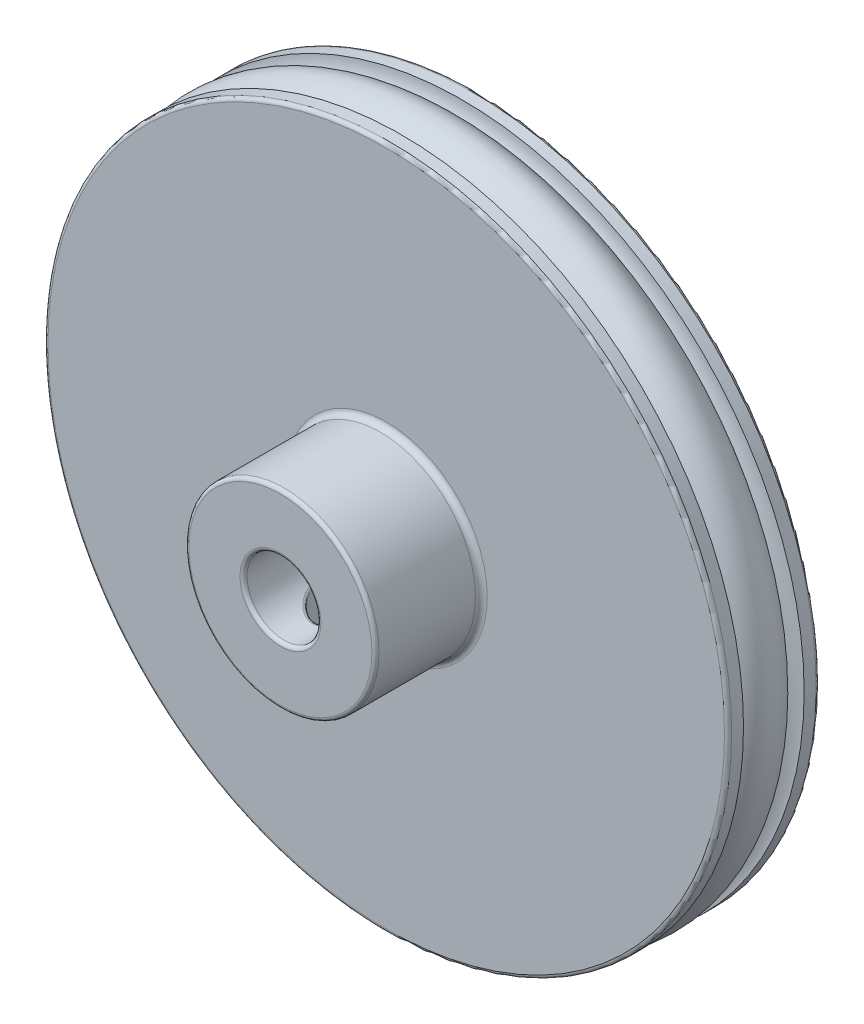
from build123d import *

# Parameters (mm, degrees)
SKETCH1_R           = 28.75
BOSS_EXTRUDE1_DEPTH = 3.85
SKETCH2_R           = 2.55
SWEEP1_OUTLINE_R    = 2.6
SKETCH4_R           = 8
BOSS_EXTRUDE2_DEPTH = 8.9
SKETCH5_R           = 3.1
CUT_EXTRUDE1_DEPTH  = 15.6
SKETCH6_R           = 2
CUT_EXTRUDE2_DEPTH  = 43.745847887
FILLET1_R           = 0.5
FILLET2_R           = 0.3
FILLET3_R           = 0.3
FILLET4_R           = 0.3
FILLET5_R           = 0.3


# Read off the part's stored shape, not the designer's step: Sweep1
with BuildPart() as part:
    # Sketch1 → Boss-Extrude1 (new, symmetric)
    with BuildSketch(Plane.XY):
        with Locations(Location((0, 0, 0), (0, 0, 180))):
            Circle(SKETCH1_R)
    extrude(amount=BOSS_EXTRUDE1_DEPTH, both=True)

    # Cut-Sweep1: sweep along a curve in space
    with BuildLine() as cut_sweep1_path:
        ThreePointArc((28.75, 0, -3.85), (20.329319959, 20.329319959, -3.85), (0, 28.75, -3.85))
        ThreePointArc((0, 28.75, -3.85), (-20.329319959, 20.329319959, -3.85), (-28.75, 0, -3.85))
        ThreePointArc((-28.75, 0, -3.85), (-20.329319959, -20.329319959, -3.85), (0, -28.75, -3.85))
        ThreePointArc((0, -28.75, -3.85), (20.329319959, -20.329319959, -3.85), (28.75, 0, -3.85))
    # Sketch2 → Cut-Sweep1 (sweep, cut)
    with BuildSketch(Plane(origin=(0, 0, 0), x_dir=(1, 0, 0), z_dir=(0, 1, 0))):
        with Locations((28.75, 0)):
            Circle(SKETCH2_R)
    sweep(path=cut_sweep1_path.line, mode=Mode.SUBTRACT)

    # Sketch4 → Boss-Extrude2 (add)
    with BuildSketch(Plane.XY.offset(3.85)):
        Circle(SKETCH4_R)
    extrude(amount=BOSS_EXTRUDE2_DEPTH)

    # Sketch5 → Cut-Extrude1 (cut)
    with BuildSketch(Plane.XY.offset(12.75)):
        Circle(SKETCH5_R)
    extrude(amount=-CUT_EXTRUDE1_DEPTH, mode=Mode.SUBTRACT)

    # Sketch6 → Cut-Extrude2 (cut, through all)
    with BuildSketch(Plane(origin=(0, 0, 0), x_dir=(1, 0, 0), z_dir=(0, 1, 0))):
        with Locations(Location((0, -7.75, 0), (0, 0, 270))):
            Circle(SKETCH6_R)
    extrude(amount=-CUT_EXTRUDE2_DEPTH, mode=Mode.SUBTRACT)

    # Fillet1
    fillet1_edges = [part.edges().sort_by_distance(p)[0] for p in [
        (-8, 0, 3.85),
    ]]
    fillet(fillet1_edges, radius=FILLET1_R)

    # Fillet2
    fillet2_edges = [part.edges().sort_by_distance(p)[0] for p in [
        (-8, 0, 12.75),
    ]]
    fillet(fillet2_edges, radius=FILLET2_R)

    # Fillet3
    fillet3_edges = [part.edges().sort_by_distance(p)[0] for p in [
        (2e-09, -3.100000006, 5.749999996),
        (1e-09, -7.999999994, 5.749999986),
    ]]
    fillet(fillet3_edges, radius=FILLET3_R)

    # Fillet4
    fillet4_edges = [part.edges().sort_by_distance(p)[0] for p in [
        (-3.1, 0, 12.75),
    ]]
    fillet(fillet4_edges, radius=FILLET4_R)

    # Fillet5
    fillet5_edges = [part.edges().sort_by_distance(p)[0] for p in [
        (28.75, 0, -3.85),
        (28.75, 0, 3.85),
    ]]
    fillet(fillet5_edges, radius=FILLET5_R)


with BuildPart() as body_2:
    # Sweep1 outline → Sweep1 (revolve)
    with BuildSketch(Plane.XZ):
        with Locations((26.25, 0)):
            Circle(SWEEP1_OUTLINE_R)
    revolve(axis=Axis((0, 0, 0), (0, 0, 1)))


solid = Compound([part.part, body_2.part])
